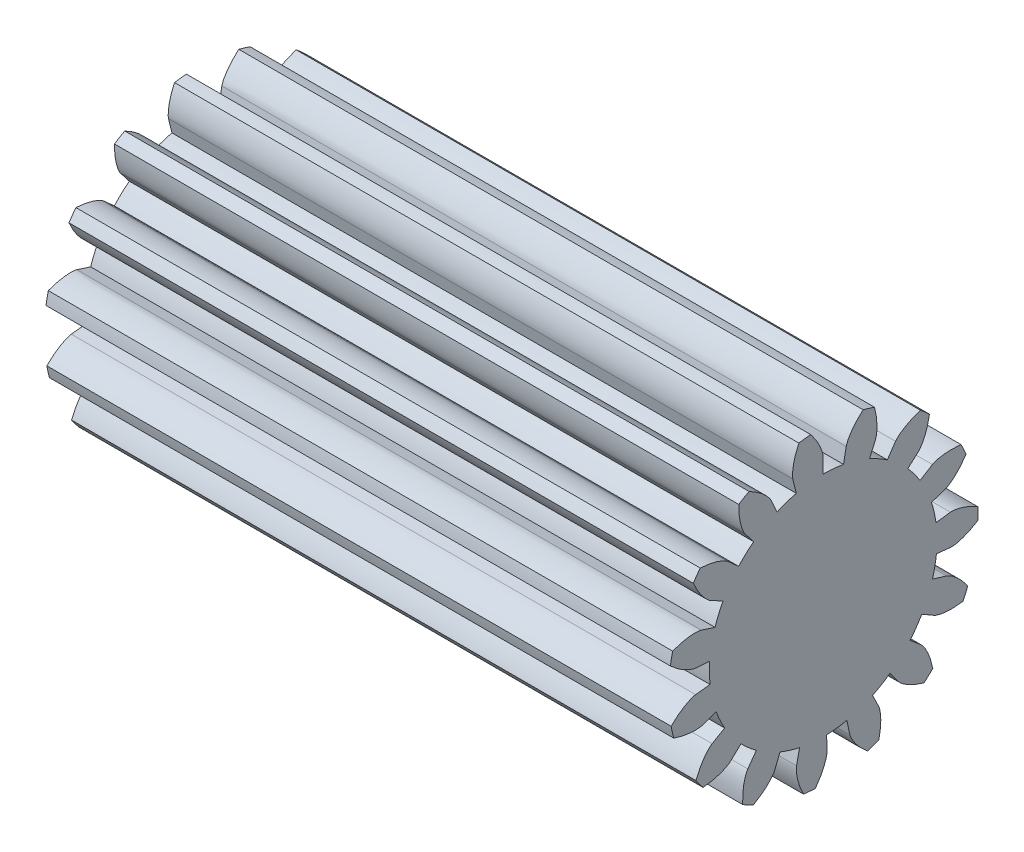
from build123d import *

# Parameters (mm, degrees)
SKETCH1_R                 = 2.833333333
BOSS_EXTRUDE1_DEPTH       = 11.43
CUT_EXTRUDE1_DEPTH        = 13.111996349
CIRPATTERN6_COUNT         = 15
CIRPATTERN6_COPY_1_DEPTH  = 13.111996349
CIRPATTERN6_COPY_2_DEPTH  = 13.111996349
CIRPATTERN6_COPY_3_DEPTH  = 13.111996349
CIRPATTERN6_COPY_4_DEPTH  = 13.111996349
CIRPATTERN6_COPY_5_DEPTH  = 13.111996349
CIRPATTERN6_COPY_6_DEPTH  = 13.111996349
CIRPATTERN6_COPY_7_DEPTH  = 13.111996349
CIRPATTERN6_COPY_8_DEPTH  = 13.111996349
CIRPATTERN6_COPY_9_DEPTH  = 13.111996349
CIRPATTERN6_COPY_10_DEPTH = 13.111996349
CIRPATTERN6_COPY_11_DEPTH = 13.111996349
CIRPATTERN6_COPY_12_DEPTH = 13.111996349
CIRPATTERN6_COPY_13_DEPTH = 13.111996349
CIRPATTERN6_COPY_14_DEPTH = 13.111996349


with BuildPart() as part:
    # Sketch1 → Boss-Extrude1 (new body)
    with BuildSketch(Plane.YZ):
        Circle(SKETCH1_R)
    extrude(amount=BOSS_EXTRUDE1_DEPTH)

    # Sketch3 → Cut-Extrude1 (cut, through all)
    with BuildSketch(Plane.YZ.offset(11.43)):
        with BuildLine():
            Line((2.489923292, -0.224236484), (2.339762544, -0.210713369))
            Line((2.339762544, -0.210713369), (2.074936077, -0.186863736))
            ThreePointArc((2.074936077, -0.186863736), (2.08123296, -0.093526159), (2.083333333, 0))
            Line((2.083333333, 0), (2.349231552, 0))
            add(Edge.make_bspline(
                [(2.349231552, 0), (2.350968346, 3.6754e-05), (2.355835834, 0.000253578), (2.370835553, 0.001656605), (2.400223443, 0.006481364), (2.436045096, 0.01536564), (2.476603798, 0.02833644), (2.515144563, 0.042994594), (2.547681354, 0.056840209), (2.579712966, 0.071857897), (2.611212746, 0.08789641), (2.648845828, 0.108578302), (2.693217496, 0.135111207), (2.743878144, 0.168588781), (2.799834182, 0.209423625), (2.855116098, 0.254005099), (2.908031101, 0.300280352), (2.959660854, 0.349692585), (3.008304545, 0.399380199), (3.056798276, 0.453569941), (3.100536534, 0.504916857), (3.147154604, 0.565154644), (3.184090219, 0.614573387), (3.220170862, 0.667780974), (3.237421449, 0.693990491), (3.246105412, 0.707514963)],
                knots=[0, 0, 0, 0, 0, 0.005376748, 0.015083688, 0.046610139, 0.092110525, 0.119476175, 0.146842495, 0.174208853, 0.201574955, 0.228941013, 0.256307345, 0.307035032, 0.361767351, 0.41649966, 0.471231936, 0.525964281, 0.580696615, 0.635428982, 0.690161387, 0.744893688, 0.799626083, 0.854358408, 0.909090916, 0.909090916, 0.909090916, 0.909090916, 0.909090916], degree=4))
            Line((3.246105412, 0.707514963), (3.246105412, -0.292336421))
            Line((3.246105412, -0.292336421), (2.489923292, -0.224236484))
        make_face()
    cut_extrude1 = extrude(amount=-CUT_EXTRUDE1_DEPTH, mode=Mode.SUBTRACT)

    # Mirror1: Cut-Extrude1 across plane
    add(cut_extrude1.mirror(Plane(origin=(0, 2.489923292, -0.224236484), x_dir=(1, 0, 0), z_dir=(0, -0.08969459343223997, -0.9959693167507849))), mode=Mode.SUBTRACT)

    # CirPattern6: Cut-Extrude1 ×15 about axis
    cirpattern6_axis = Axis((11.43, 0, 0), (-1, 0, 0))
    for i in range(1, CIRPATTERN6_COUNT):
        add(cut_extrude1.rotate(cirpattern6_axis, i * 360 / CIRPATTERN6_COUNT), mode=Mode.SUBTRACT)

    # CirPattern6 copy 1 sketch → CirPattern6 copy 1 (cut, through all)
    with BuildSketch(Plane(origin=(11.43, 0, 0), x_dir=(0, 0.8261762315426959, -0.5634117805246086), z_dir=(1, 0, 0))):
        with BuildLine():
            Line((2.489923292, 0.224236484), (2.339762544, 0.210713369))
            Line((2.339762544, 0.210713369), (2.074936077, 0.186863736))
            ThreePointArc((2.074936077, 0.186863736), (2.08123296, 0.093526159), (2.083333333, 0))
            Line((2.083333333, 0), (2.349231552, 0))
            add(Edge.make_bspline(
                [(2.349231552, 0), (2.350968346, -3.6754e-05), (2.355835834, -0.000253578), (2.370835553, -0.001656605), (2.400223443, -0.006481364), (2.436045096, -0.01536564), (2.476603798, -0.02833644), (2.515144563, -0.042994594), (2.547681354, -0.056840209), (2.579712966, -0.071857897), (2.611212746, -0.08789641), (2.648845828, -0.108578302), (2.693217496, -0.135111207), (2.743878144, -0.168588781), (2.799834182, -0.209423625), (2.855116098, -0.254005099), (2.908031101, -0.300280352), (2.959660854, -0.349692585), (3.008304545, -0.399380199), (3.056798276, -0.453569941), (3.100536534, -0.504916857), (3.147154604, -0.565154644), (3.184090219, -0.614573387), (3.220170862, -0.667780974), (3.237421449, -0.693990491), (3.246105412, -0.707514963)],
                knots=[0, 0, 0, 0, 0, 0.005376748, 0.015083688, 0.046610139, 0.092110525, 0.119476175, 0.146842495, 0.174208853, 0.201574955, 0.228941013, 0.256307345, 0.307035032, 0.361767351, 0.41649966, 0.471231936, 0.525964281, 0.580696615, 0.635428982, 0.690161387, 0.744893688, 0.799626083, 0.854358408, 0.909090916, 0.909090916, 0.909090916, 0.909090916, 0.909090916], degree=4))
            Line((3.246105412, -0.707514963), (3.246105412, 0.292336421))
            Line((3.246105412, 0.292336421), (2.489923292, 0.224236484))
        make_face()
    extrude(amount=-CIRPATTERN6_COPY_1_DEPTH, mode=Mode.SUBTRACT)

    # CirPattern6 copy 2 sketch → CirPattern6 copy 2 (cut, through all)
    with BuildSketch(Plane(origin=(11.43, 0, 0), x_dir=(0, 0.5255893272581728, -0.8507384198872774), z_dir=(1, 0, 0))):
        with BuildLine():
            Line((2.489923292, 0.224236484), (2.339762544, 0.210713369))
            Line((2.339762544, 0.210713369), (2.074936077, 0.186863736))
            ThreePointArc((2.074936077, 0.186863736), (2.08123296, 0.093526159), (2.083333333, 0))
            Line((2.083333333, 0), (2.349231552, 0))
            add(Edge.make_bspline(
                [(2.349231552, 0), (2.350968346, -3.6754e-05), (2.355835834, -0.000253578), (2.370835553, -0.001656605), (2.400223443, -0.006481364), (2.436045096, -0.01536564), (2.476603798, -0.02833644), (2.515144563, -0.042994594), (2.547681354, -0.056840209), (2.579712966, -0.071857897), (2.611212746, -0.08789641), (2.648845828, -0.108578302), (2.693217496, -0.135111207), (2.743878144, -0.168588781), (2.799834182, -0.209423625), (2.855116098, -0.254005099), (2.908031101, -0.300280352), (2.959660854, -0.349692585), (3.008304545, -0.399380199), (3.056798276, -0.453569941), (3.100536534, -0.504916857), (3.147154604, -0.565154644), (3.184090219, -0.614573387), (3.220170862, -0.667780974), (3.237421449, -0.693990491), (3.246105412, -0.707514963)],
                knots=[0, 0, 0, 0, 0, 0.005376748, 0.015083688, 0.046610139, 0.092110525, 0.119476175, 0.146842495, 0.174208853, 0.201574955, 0.228941013, 0.256307345, 0.307035032, 0.361767351, 0.41649966, 0.471231936, 0.525964281, 0.580696615, 0.635428982, 0.690161387, 0.744893688, 0.799626083, 0.854358408, 0.909090916, 0.909090916, 0.909090916, 0.909090916, 0.909090916], degree=4))
            Line((3.246105412, -0.707514963), (3.246105412, 0.292336421))
            Line((3.246105412, 0.292336421), (2.489923292, 0.224236484))
        make_face()
    extrude(amount=-CIRPATTERN6_COPY_2_DEPTH, mode=Mode.SUBTRACT)

    # CirPattern6 copy 3 sketch → CirPattern6 copy 3 (cut, through all)
    with BuildSketch(Plane(origin=(11.43, 0, 0), x_dir=(0, 0.13412325346157242, -0.9909646577355233), z_dir=(1, 0, 0))):
        with BuildLine():
            Line((2.489923292, 0.224236484), (2.339762544, 0.210713369))
            Line((2.339762544, 0.210713369), (2.074936077, 0.186863736))
            ThreePointArc((2.074936077, 0.186863736), (2.08123296, 0.093526159), (2.083333333, 0))
            Line((2.083333333, 0), (2.349231552, 0))
            add(Edge.make_bspline(
                [(2.349231552, 0), (2.350968346, -3.6754e-05), (2.355835834, -0.000253578), (2.370835553, -0.001656605), (2.400223443, -0.006481364), (2.436045096, -0.01536564), (2.476603798, -0.02833644), (2.515144563, -0.042994594), (2.547681354, -0.056840209), (2.579712966, -0.071857897), (2.611212746, -0.08789641), (2.648845828, -0.108578302), (2.693217496, -0.135111207), (2.743878144, -0.168588781), (2.799834182, -0.209423625), (2.855116098, -0.254005099), (2.908031101, -0.300280352), (2.959660854, -0.349692585), (3.008304545, -0.399380199), (3.056798276, -0.453569941), (3.100536534, -0.504916857), (3.147154604, -0.565154644), (3.184090219, -0.614573387), (3.220170862, -0.667780974), (3.237421449, -0.693990491), (3.246105412, -0.707514963)],
                knots=[0, 0, 0, 0, 0, 0.005376748, 0.015083688, 0.046610139, 0.092110525, 0.119476175, 0.146842495, 0.174208853, 0.201574955, 0.228941013, 0.256307345, 0.307035032, 0.361767351, 0.41649966, 0.471231936, 0.525964281, 0.580696615, 0.635428982, 0.690161387, 0.744893688, 0.799626083, 0.854358408, 0.909090916, 0.909090916, 0.909090916, 0.909090916, 0.909090916], degree=4))
            Line((3.246105412, -0.707514963), (3.246105412, 0.292336421))
            Line((3.246105412, 0.292336421), (2.489923292, 0.224236484))
        make_face()
    extrude(amount=-CIRPATTERN6_COPY_3_DEPTH, mode=Mode.SUBTRACT)

    # CirPattern6 copy 4 sketch → CirPattern6 copy 4 (cut, through all)
    with BuildSketch(Plane(origin=(11.43, 0, 0), x_dir=(0, -0.2805339493300394, -0.9598441036300067), z_dir=(1, 0, 0))):
        with BuildLine():
            Line((2.489923292, 0.224236484), (2.339762544, 0.210713369))
            Line((2.339762544, 0.210713369), (2.074936077, 0.186863736))
            ThreePointArc((2.074936077, 0.186863736), (2.08123296, 0.093526159), (2.083333333, 0))
            Line((2.083333333, 0), (2.349231552, 0))
            add(Edge.make_bspline(
                [(2.349231552, 0), (2.350968346, -3.6754e-05), (2.355835834, -0.000253578), (2.370835553, -0.001656605), (2.400223443, -0.006481364), (2.436045096, -0.01536564), (2.476603798, -0.02833644), (2.515144563, -0.042994594), (2.547681354, -0.056840209), (2.579712966, -0.071857897), (2.611212746, -0.08789641), (2.648845828, -0.108578302), (2.693217496, -0.135111207), (2.743878144, -0.168588781), (2.799834182, -0.209423625), (2.855116098, -0.254005099), (2.908031101, -0.300280352), (2.959660854, -0.349692585), (3.008304545, -0.399380199), (3.056798276, -0.453569941), (3.100536534, -0.504916857), (3.147154604, -0.565154644), (3.184090219, -0.614573387), (3.220170862, -0.667780974), (3.237421449, -0.693990491), (3.246105412, -0.707514963)],
                knots=[0, 0, 0, 0, 0, 0.005376748, 0.015083688, 0.046610139, 0.092110525, 0.119476175, 0.146842495, 0.174208853, 0.201574955, 0.228941013, 0.256307345, 0.307035032, 0.361767351, 0.41649966, 0.471231936, 0.525964281, 0.580696615, 0.635428982, 0.690161387, 0.744893688, 0.799626083, 0.854358408, 0.909090916, 0.909090916, 0.909090916, 0.909090916, 0.909090916], degree=4))
            Line((3.246105412, -0.707514963), (3.246105412, 0.292336421))
            Line((3.246105412, 0.292336421), (2.489923292, 0.224236484))
        make_face()
    extrude(amount=-CIRPATTERN6_COPY_4_DEPTH, mode=Mode.SUBTRACT)

    # CirPattern6 copy 5 sketch → CirPattern6 copy 5 (cut, through all)
    with BuildSketch(Plane(origin=(11.43, 0, 0), x_dir=(0, -0.6466842837115663, -0.7627577840969297), z_dir=(1, 0, 0))):
        with BuildLine():
            Line((2.489923292, 0.224236484), (2.339762544, 0.210713369))
            Line((2.339762544, 0.210713369), (2.074936077, 0.186863736))
            ThreePointArc((2.074936077, 0.186863736), (2.08123296, 0.093526159), (2.083333333, 0))
            Line((2.083333333, 0), (2.349231552, 0))
            add(Edge.make_bspline(
                [(2.349231552, 0), (2.350968346, -3.6754e-05), (2.355835834, -0.000253578), (2.370835553, -0.001656605), (2.400223443, -0.006481364), (2.436045096, -0.01536564), (2.476603798, -0.02833644), (2.515144563, -0.042994594), (2.547681354, -0.056840209), (2.579712966, -0.071857897), (2.611212746, -0.08789641), (2.648845828, -0.108578302), (2.693217496, -0.135111207), (2.743878144, -0.168588781), (2.799834182, -0.209423625), (2.855116098, -0.254005099), (2.908031101, -0.300280352), (2.959660854, -0.349692585), (3.008304545, -0.399380199), (3.056798276, -0.453569941), (3.100536534, -0.504916857), (3.147154604, -0.565154644), (3.184090219, -0.614573387), (3.220170862, -0.667780974), (3.237421449, -0.693990491), (3.246105412, -0.707514963)],
                knots=[0, 0, 0, 0, 0, 0.005376748, 0.015083688, 0.046610139, 0.092110525, 0.119476175, 0.146842495, 0.174208853, 0.201574955, 0.228941013, 0.256307345, 0.307035032, 0.361767351, 0.41649966, 0.471231936, 0.525964281, 0.580696615, 0.635428982, 0.690161387, 0.744893688, 0.799626083, 0.854358408, 0.909090916, 0.909090916, 0.909090916, 0.909090916, 0.909090916], degree=4))
            Line((3.246105412, -0.707514963), (3.246105412, 0.292336421))
            Line((3.246105412, 0.292336421), (2.489923292, 0.224236484))
        make_face()
    extrude(amount=-CIRPATTERN6_COPY_5_DEPTH, mode=Mode.SUBTRACT)

    # CirPattern6 copy 6 sketch → CirPattern6 copy 6 (cut, through all)
    with BuildSketch(Plane(origin=(11.43, 0, 0), x_dir=(0, -0.9010170304970816, -0.43378371425656503), z_dir=(1, 0, 0))):
        with BuildLine():
            Line((2.489923292, 0.224236484), (2.339762544, 0.210713369))
            Line((2.339762544, 0.210713369), (2.074936077, 0.186863736))
            ThreePointArc((2.074936077, 0.186863736), (2.08123296, 0.093526159), (2.083333333, 0))
            Line((2.083333333, 0), (2.349231552, 0))
            add(Edge.make_bspline(
                [(2.349231552, 0), (2.350968346, -3.6754e-05), (2.355835834, -0.000253578), (2.370835553, -0.001656605), (2.400223443, -0.006481364), (2.436045096, -0.01536564), (2.476603798, -0.02833644), (2.515144563, -0.042994594), (2.547681354, -0.056840209), (2.579712966, -0.071857897), (2.611212746, -0.08789641), (2.648845828, -0.108578302), (2.693217496, -0.135111207), (2.743878144, -0.168588781), (2.799834182, -0.209423625), (2.855116098, -0.254005099), (2.908031101, -0.300280352), (2.959660854, -0.349692585), (3.008304545, -0.399380199), (3.056798276, -0.453569941), (3.100536534, -0.504916857), (3.147154604, -0.565154644), (3.184090219, -0.614573387), (3.220170862, -0.667780974), (3.237421449, -0.693990491), (3.246105412, -0.707514963)],
                knots=[0, 0, 0, 0, 0, 0.005376748, 0.015083688, 0.046610139, 0.092110525, 0.119476175, 0.146842495, 0.174208853, 0.201574955, 0.228941013, 0.256307345, 0.307035032, 0.361767351, 0.41649966, 0.471231936, 0.525964281, 0.580696615, 0.635428982, 0.690161387, 0.744893688, 0.799626083, 0.854358408, 0.909090916, 0.909090916, 0.909090916, 0.909090916, 0.909090916], degree=4))
            Line((3.246105412, -0.707514963), (3.246105412, 0.292336421))
            Line((3.246105412, 0.292336421), (2.489923292, 0.224236484))
        make_face()
    extrude(amount=-CIRPATTERN6_COPY_6_DEPTH, mode=Mode.SUBTRACT)

    # CirPattern6 copy 7 sketch → CirPattern6 copy 7 (cut, through all)
    with BuildSketch(Plane(origin=(11.43, 0, 0), x_dir=(0, -0.9995557472269011, -0.02980449941991184), z_dir=(1, 0, 0))):
        with BuildLine():
            Line((2.489923292, 0.224236484), (2.339762544, 0.210713369))
            Line((2.339762544, 0.210713369), (2.074936077, 0.186863736))
            ThreePointArc((2.074936077, 0.186863736), (2.08123296, 0.093526159), (2.083333333, 0))
            Line((2.083333333, 0), (2.349231552, 0))
            add(Edge.make_bspline(
                [(2.349231552, 0), (2.350968346, -3.6754e-05), (2.355835834, -0.000253578), (2.370835553, -0.001656605), (2.400223443, -0.006481364), (2.436045096, -0.01536564), (2.476603798, -0.02833644), (2.515144563, -0.042994594), (2.547681354, -0.056840209), (2.579712966, -0.071857897), (2.611212746, -0.08789641), (2.648845828, -0.108578302), (2.693217496, -0.135111207), (2.743878144, -0.168588781), (2.799834182, -0.209423625), (2.855116098, -0.254005099), (2.908031101, -0.300280352), (2.959660854, -0.349692585), (3.008304545, -0.399380199), (3.056798276, -0.453569941), (3.100536534, -0.504916857), (3.147154604, -0.565154644), (3.184090219, -0.614573387), (3.220170862, -0.667780974), (3.237421449, -0.693990491), (3.246105412, -0.707514963)],
                knots=[0, 0, 0, 0, 0, 0.005376748, 0.015083688, 0.046610139, 0.092110525, 0.119476175, 0.146842495, 0.174208853, 0.201574955, 0.228941013, 0.256307345, 0.307035032, 0.361767351, 0.41649966, 0.471231936, 0.525964281, 0.580696615, 0.635428982, 0.690161387, 0.744893688, 0.799626083, 0.854358408, 0.909090916, 0.909090916, 0.909090916, 0.909090916, 0.909090916], degree=4))
            Line((3.246105412, -0.707514963), (3.246105412, 0.292336421))
            Line((3.246105412, 0.292336421), (2.489923292, 0.224236484))
        make_face()
    extrude(amount=-CIRPATTERN6_COPY_7_DEPTH, mode=Mode.SUBTRACT)

    # CirPattern6 copy 8 sketch → CirPattern6 copy 8 (cut, through all)
    with BuildSketch(Plane(origin=(11.43, 0, 0), x_dir=(0, -0.9252621945823007, 0.379328184131821), z_dir=(1, 0, 0))):
        with BuildLine():
            Line((2.489923292, 0.224236484), (2.339762544, 0.210713369))
            Line((2.339762544, 0.210713369), (2.074936077, 0.186863736))
            ThreePointArc((2.074936077, 0.186863736), (2.08123296, 0.093526159), (2.083333333, 0))
            Line((2.083333333, 0), (2.349231552, 0))
            add(Edge.make_bspline(
                [(2.349231552, 0), (2.350968346, -3.6754e-05), (2.355835834, -0.000253578), (2.370835553, -0.001656605), (2.400223443, -0.006481364), (2.436045096, -0.01536564), (2.476603798, -0.02833644), (2.515144563, -0.042994594), (2.547681354, -0.056840209), (2.579712966, -0.071857897), (2.611212746, -0.08789641), (2.648845828, -0.108578302), (2.693217496, -0.135111207), (2.743878144, -0.168588781), (2.799834182, -0.209423625), (2.855116098, -0.254005099), (2.908031101, -0.300280352), (2.959660854, -0.349692585), (3.008304545, -0.399380199), (3.056798276, -0.453569941), (3.100536534, -0.504916857), (3.147154604, -0.565154644), (3.184090219, -0.614573387), (3.220170862, -0.667780974), (3.237421449, -0.693990491), (3.246105412, -0.707514963)],
                knots=[0, 0, 0, 0, 0, 0.005376748, 0.015083688, 0.046610139, 0.092110525, 0.119476175, 0.146842495, 0.174208853, 0.201574955, 0.228941013, 0.256307345, 0.307035032, 0.361767351, 0.41649966, 0.471231936, 0.525964281, 0.580696615, 0.635428982, 0.690161387, 0.744893688, 0.799626083, 0.854358408, 0.909090916, 0.909090916, 0.909090916, 0.909090916, 0.909090916], degree=4))
            Line((3.246105412, -0.707514963), (3.246105412, 0.292336421))
            Line((3.246105412, 0.292336421), (2.489923292, 0.224236484))
        make_face()
    extrude(amount=-CIRPATTERN6_COPY_8_DEPTH, mode=Mode.SUBTRACT)

    # CirPattern6 copy 9 sketch → CirPattern6 copy 9 (cut, through all)
    with BuildSketch(Plane(origin=(11.43, 0, 0), x_dir=(0, -0.6909824027512695, 0.7228715785587938), z_dir=(1, 0, 0))):
        with BuildLine():
            Line((2.489923292, 0.224236484), (2.339762544, 0.210713369))
            Line((2.339762544, 0.210713369), (2.074936077, 0.186863736))
            ThreePointArc((2.074936077, 0.186863736), (2.08123296, 0.093526159), (2.083333333, 0))
            Line((2.083333333, 0), (2.349231552, 0))
            add(Edge.make_bspline(
                [(2.349231552, 0), (2.350968346, -3.6754e-05), (2.355835834, -0.000253578), (2.370835553, -0.001656605), (2.400223443, -0.006481364), (2.436045096, -0.01536564), (2.476603798, -0.02833644), (2.515144563, -0.042994594), (2.547681354, -0.056840209), (2.579712966, -0.071857897), (2.611212746, -0.08789641), (2.648845828, -0.108578302), (2.693217496, -0.135111207), (2.743878144, -0.168588781), (2.799834182, -0.209423625), (2.855116098, -0.254005099), (2.908031101, -0.300280352), (2.959660854, -0.349692585), (3.008304545, -0.399380199), (3.056798276, -0.453569941), (3.100536534, -0.504916857), (3.147154604, -0.565154644), (3.184090219, -0.614573387), (3.220170862, -0.667780974), (3.237421449, -0.693990491), (3.246105412, -0.707514963)],
                knots=[0, 0, 0, 0, 0, 0.005376748, 0.015083688, 0.046610139, 0.092110525, 0.119476175, 0.146842495, 0.174208853, 0.201574955, 0.228941013, 0.256307345, 0.307035032, 0.361767351, 0.41649966, 0.471231936, 0.525964281, 0.580696615, 0.635428982, 0.690161387, 0.744893688, 0.799626083, 0.854358408, 0.909090916, 0.909090916, 0.909090916, 0.909090916, 0.909090916], degree=4))
            Line((3.246105412, -0.707514963), (3.246105412, 0.292336421))
            Line((3.246105412, 0.292336421), (2.489923292, 0.224236484))
        make_face()
    extrude(amount=-CIRPATTERN6_COPY_9_DEPTH, mode=Mode.SUBTRACT)

    # CirPattern6 copy 10 sketch → CirPattern6 copy 10 (cut, through all)
    with BuildSketch(Plane(origin=(11.43, 0, 0), x_dir=(0, -0.33722547610648446, 0.9414239099708244), z_dir=(1, 0, 0))):
        with BuildLine():
            Line((2.489923292, 0.224236484), (2.339762544, 0.210713369))
            Line((2.339762544, 0.210713369), (2.074936077, 0.186863736))
            ThreePointArc((2.074936077, 0.186863736), (2.08123296, 0.093526159), (2.083333333, 0))
            Line((2.083333333, 0), (2.349231552, 0))
            add(Edge.make_bspline(
                [(2.349231552, 0), (2.350968346, -3.6754e-05), (2.355835834, -0.000253578), (2.370835553, -0.001656605), (2.400223443, -0.006481364), (2.436045096, -0.01536564), (2.476603798, -0.02833644), (2.515144563, -0.042994594), (2.547681354, -0.056840209), (2.579712966, -0.071857897), (2.611212746, -0.08789641), (2.648845828, -0.108578302), (2.693217496, -0.135111207), (2.743878144, -0.168588781), (2.799834182, -0.209423625), (2.855116098, -0.254005099), (2.908031101, -0.300280352), (2.959660854, -0.349692585), (3.008304545, -0.399380199), (3.056798276, -0.453569941), (3.100536534, -0.504916857), (3.147154604, -0.565154644), (3.184090219, -0.614573387), (3.220170862, -0.667780974), (3.237421449, -0.693990491), (3.246105412, -0.707514963)],
                knots=[0, 0, 0, 0, 0, 0.005376748, 0.015083688, 0.046610139, 0.092110525, 0.119476175, 0.146842495, 0.174208853, 0.201574955, 0.228941013, 0.256307345, 0.307035032, 0.361767351, 0.41649966, 0.471231936, 0.525964281, 0.580696615, 0.635428982, 0.690161387, 0.744893688, 0.799626083, 0.854358408, 0.909090916, 0.909090916, 0.909090916, 0.909090916, 0.909090916], degree=4))
            Line((3.246105412, -0.707514963), (3.246105412, 0.292336421))
            Line((3.246105412, 0.292336421), (2.489923292, 0.224236484))
        make_face()
    extrude(amount=-CIRPATTERN6_COPY_10_DEPTH, mode=Mode.SUBTRACT)

    # CirPattern6 copy 11 sketch → CirPattern6 copy 11 (cut, through all)
    with BuildSketch(Plane(origin=(11.43, 0, 0), x_dir=(0, 0.0748407989543858, 0.9971954947811735), z_dir=(1, 0, 0))):
        with BuildLine():
            Line((2.489923292, 0.224236484), (2.339762544, 0.210713369))
            Line((2.339762544, 0.210713369), (2.074936077, 0.186863736))
            ThreePointArc((2.074936077, 0.186863736), (2.08123296, 0.093526159), (2.083333333, 0))
            Line((2.083333333, 0), (2.349231552, 0))
            add(Edge.make_bspline(
                [(2.349231552, 0), (2.350968346, -3.6754e-05), (2.355835834, -0.000253578), (2.370835553, -0.001656605), (2.400223443, -0.006481364), (2.436045096, -0.01536564), (2.476603798, -0.02833644), (2.515144563, -0.042994594), (2.547681354, -0.056840209), (2.579712966, -0.071857897), (2.611212746, -0.08789641), (2.648845828, -0.108578302), (2.693217496, -0.135111207), (2.743878144, -0.168588781), (2.799834182, -0.209423625), (2.855116098, -0.254005099), (2.908031101, -0.300280352), (2.959660854, -0.349692585), (3.008304545, -0.399380199), (3.056798276, -0.453569941), (3.100536534, -0.504916857), (3.147154604, -0.565154644), (3.184090219, -0.614573387), (3.220170862, -0.667780974), (3.237421449, -0.693990491), (3.246105412, -0.707514963)],
                knots=[0, 0, 0, 0, 0, 0.005376748, 0.015083688, 0.046610139, 0.092110525, 0.119476175, 0.146842495, 0.174208853, 0.201574955, 0.228941013, 0.256307345, 0.307035032, 0.361767351, 0.41649966, 0.471231936, 0.525964281, 0.580696615, 0.635428982, 0.690161387, 0.744893688, 0.799626083, 0.854358408, 0.909090916, 0.909090916, 0.909090916, 0.909090916, 0.909090916], degree=4))
            Line((3.246105412, -0.707514963), (3.246105412, 0.292336421))
            Line((3.246105412, 0.292336421), (2.489923292, 0.224236484))
        make_face()
    extrude(amount=-CIRPATTERN6_COPY_11_DEPTH, mode=Mode.SUBTRACT)

    # CirPattern6 copy 12 sketch → CirPattern6 copy 12 (cut, through all)
    with BuildSketch(Plane(origin=(11.43, 0, 0), x_dir=(0, 0.4739664199687281, 0.8805429193071894), z_dir=(1, 0, 0))):
        with BuildLine():
            Line((2.489923292, 0.224236484), (2.339762544, 0.210713369))
            Line((2.339762544, 0.210713369), (2.074936077, 0.186863736))
            ThreePointArc((2.074936077, 0.186863736), (2.08123296, 0.093526159), (2.083333333, 0))
            Line((2.083333333, 0), (2.349231552, 0))
            add(Edge.make_bspline(
                [(2.349231552, 0), (2.350968346, -3.6754e-05), (2.355835834, -0.000253578), (2.370835553, -0.001656605), (2.400223443, -0.006481364), (2.436045096, -0.01536564), (2.476603798, -0.02833644), (2.515144563, -0.042994594), (2.547681354, -0.056840209), (2.579712966, -0.071857897), (2.611212746, -0.08789641), (2.648845828, -0.108578302), (2.693217496, -0.135111207), (2.743878144, -0.168588781), (2.799834182, -0.209423625), (2.855116098, -0.254005099), (2.908031101, -0.300280352), (2.959660854, -0.349692585), (3.008304545, -0.399380199), (3.056798276, -0.453569941), (3.100536534, -0.504916857), (3.147154604, -0.565154644), (3.184090219, -0.614573387), (3.220170862, -0.667780974), (3.237421449, -0.693990491), (3.246105412, -0.707514963)],
                knots=[0, 0, 0, 0, 0, 0.005376748, 0.015083688, 0.046610139, 0.092110525, 0.119476175, 0.146842495, 0.174208853, 0.201574955, 0.228941013, 0.256307345, 0.307035032, 0.361767351, 0.41649966, 0.471231936, 0.525964281, 0.580696615, 0.635428982, 0.690161387, 0.744893688, 0.799626083, 0.854358408, 0.909090916, 0.909090916, 0.909090916, 0.909090916, 0.909090916], degree=4))
            Line((3.246105412, -0.707514963), (3.246105412, 0.292336421))
            Line((3.246105412, 0.292336421), (2.489923292, 0.224236484))
        make_face()
    extrude(amount=-CIRPATTERN6_COPY_12_DEPTH, mode=Mode.SUBTRACT)

    # CirPattern6 copy 13 sketch → CirPattern6 copy 13 (cut, through all)
    with BuildSketch(Plane(origin=(11.43, 0, 0), x_dir=(0, 0.791138941120728, 0.611636473603703), z_dir=(1, 0, 0))):
        with BuildLine():
            Line((2.489923292, 0.224236484), (2.339762544, 0.210713369))
            Line((2.339762544, 0.210713369), (2.074936077, 0.186863736))
            ThreePointArc((2.074936077, 0.186863736), (2.08123296, 0.093526159), (2.083333333, 0))
            Line((2.083333333, 0), (2.349231552, 0))
            add(Edge.make_bspline(
                [(2.349231552, 0), (2.350968346, -3.6754e-05), (2.355835834, -0.000253578), (2.370835553, -0.001656605), (2.400223443, -0.006481364), (2.436045096, -0.01536564), (2.476603798, -0.02833644), (2.515144563, -0.042994594), (2.547681354, -0.056840209), (2.579712966, -0.071857897), (2.611212746, -0.08789641), (2.648845828, -0.108578302), (2.693217496, -0.135111207), (2.743878144, -0.168588781), (2.799834182, -0.209423625), (2.855116098, -0.254005099), (2.908031101, -0.300280352), (2.959660854, -0.349692585), (3.008304545, -0.399380199), (3.056798276, -0.453569941), (3.100536534, -0.504916857), (3.147154604, -0.565154644), (3.184090219, -0.614573387), (3.220170862, -0.667780974), (3.237421449, -0.693990491), (3.246105412, -0.707514963)],
                knots=[0, 0, 0, 0, 0, 0.005376748, 0.015083688, 0.046610139, 0.092110525, 0.119476175, 0.146842495, 0.174208853, 0.201574955, 0.228941013, 0.256307345, 0.307035032, 0.361767351, 0.41649966, 0.471231936, 0.525964281, 0.580696615, 0.635428982, 0.690161387, 0.744893688, 0.799626083, 0.854358408, 0.909090916, 0.909090916, 0.909090916, 0.909090916, 0.909090916], degree=4))
            Line((3.246105412, -0.707514963), (3.246105412, 0.292336421))
            Line((3.246105412, 0.292336421), (2.489923292, 0.224236484))
        make_face()
    extrude(amount=-CIRPATTERN6_COPY_13_DEPTH, mode=Mode.SUBTRACT)

    # CirPattern6 copy 14 sketch → CirPattern6 copy 14 (cut, through all)
    with BuildSketch(Plane(origin=(11.43, 0, 0), x_dir=(0, 0.9715163520813089, 0.23697252507121266), z_dir=(1, 0, 0))):
        with BuildLine():
            Line((2.489923292, 0.224236484), (2.339762544, 0.210713369))
            Line((2.339762544, 0.210713369), (2.074936077, 0.186863736))
            ThreePointArc((2.074936077, 0.186863736), (2.08123296, 0.093526159), (2.083333333, 0))
            Line((2.083333333, 0), (2.349231552, 0))
            add(Edge.make_bspline(
                [(2.349231552, 0), (2.350968346, -3.6754e-05), (2.355835834, -0.000253578), (2.370835553, -0.001656605), (2.400223443, -0.006481364), (2.436045096, -0.01536564), (2.476603798, -0.02833644), (2.515144563, -0.042994594), (2.547681354, -0.056840209), (2.579712966, -0.071857897), (2.611212746, -0.08789641), (2.648845828, -0.108578302), (2.693217496, -0.135111207), (2.743878144, -0.168588781), (2.799834182, -0.209423625), (2.855116098, -0.254005099), (2.908031101, -0.300280352), (2.959660854, -0.349692585), (3.008304545, -0.399380199), (3.056798276, -0.453569941), (3.100536534, -0.504916857), (3.147154604, -0.565154644), (3.184090219, -0.614573387), (3.220170862, -0.667780974), (3.237421449, -0.693990491), (3.246105412, -0.707514963)],
                knots=[0, 0, 0, 0, 0, 0.005376748, 0.015083688, 0.046610139, 0.092110525, 0.119476175, 0.146842495, 0.174208853, 0.201574955, 0.228941013, 0.256307345, 0.307035032, 0.361767351, 0.41649966, 0.471231936, 0.525964281, 0.580696615, 0.635428982, 0.690161387, 0.744893688, 0.799626083, 0.854358408, 0.909090916, 0.909090916, 0.909090916, 0.909090916, 0.909090916], degree=4))
            Line((3.246105412, -0.707514963), (3.246105412, 0.292336421))
            Line((3.246105412, 0.292336421), (2.489923292, 0.224236484))
        make_face()
    extrude(amount=-CIRPATTERN6_COPY_14_DEPTH, mode=Mode.SUBTRACT)


solid = part.part
